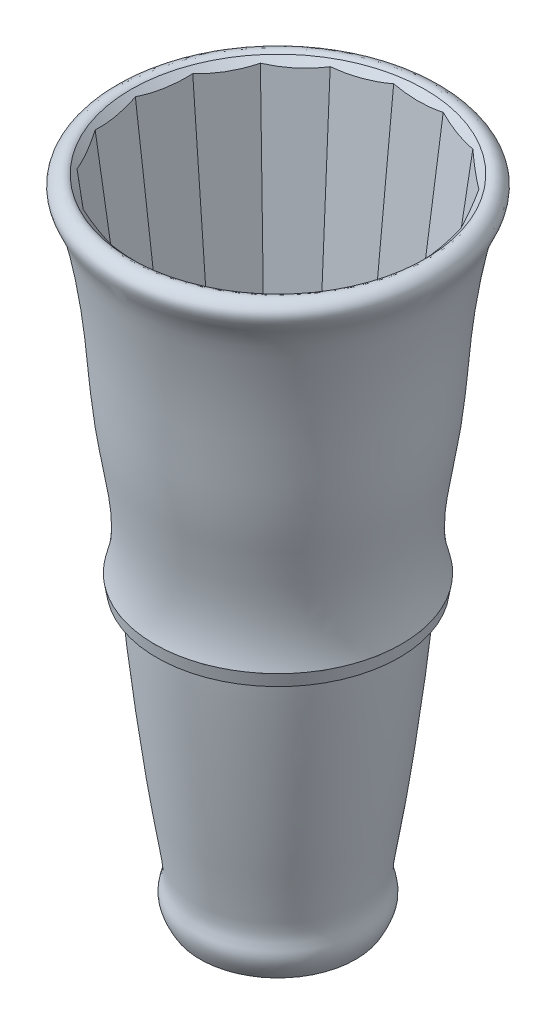
from build123d import *

# Parameters (mm, degrees)
LOFT1_DEPTH        = 508
LOFT1_TAPER        = -7.093868
SHELL1_T           = -19.05
SKETCH5_R          = 147.867108762
CUT_EXTRUDE1_DEPTH = 20
CUT_EXTRUDE2_DEPTH = 526.768458633
CUT_EXTRUDE2_TAPER = -20
CIRPATTERN1_COUNT  = 18


with BuildPart() as part:
    # Loft1: read off the stored shape, not the designer's step
    # Loft1 outline → Loft1 (new body)
    with BuildSketch(Plane(origin=(0, -508, 0), x_dir=(1, 0, 0), z_dir=(0, 1, 0))):
        Polygon((31.896938478, -55.24711805), (48.868944947, -41.005913681), (59.946635427, -21.81879094), (63.793876956, 0), (59.946635427, 21.81879094), (48.868944947, 41.005913681), (31.896938478, 55.24711805), (11.07769048, 62.824704621), (-11.07769048, 62.824704621), (-31.896938478, 55.24711805), (-48.868944947, 41.005913681), (-59.946635427, 21.81879094), (-63.793876956, 0), (-59.946635427, -21.81879094), (-48.868944947, -41.005913681), (-31.896938478, -55.24711805), (-11.07769048, -62.824704621), (11.07769048, -62.824704621), align=None)
    extrude(amount=LOFT1_DEPTH, taper=LOFT1_TAPER)

    # Shell1
    shell1_openings = [part.faces().sort_by_distance(p)[0] for p in [
        (0, 0, 0),
    ]]
    offset(amount=SHELL1_T, openings=shell1_openings, kind=Kind.INTERSECTION)

    # Sketch5 → Cut-Extrude1 (cut)
    with BuildSketch(Plane.XZ.offset(508)):
        Circle(SKETCH5_R)
    extrude(amount=-CUT_EXTRUDE1_DEPTH, mode=Mode.SUBTRACT)

    # Sketch6 → Cut-Extrude2 (cut, through all)
    with BuildSketch(Plane(origin=(-57.914835054, -472.553286642, -10.211948003), x_dir=(0.173648177666931, 0, -0.984807753012208), z_dir=(-0.12161910183404463, -0.9923451605496023, -0.021444729022872505))):
        Polygon((-11.516560933, 125.079390032), (-8.131620777, 106.029390032), (8.131620777, 106.029390032), (11.516560933, 125.079390032), align=None)
    cut_extrude2 = extrude(amount=CUT_EXTRUDE2_DEPTH, taper=CUT_EXTRUDE2_TAPER, mode=Mode.SUBTRACT)

    # CirPattern1: Cut-Extrude2 ×18 about axis
    cirpattern1_axis = Axis((0, 0, 0), (0, 1, 0))
    for i in range(1, CIRPATTERN1_COUNT):
        add(cut_extrude2.rotate(cirpattern1_axis, i * 360 / CIRPATTERN1_COUNT), mode=Mode.SUBTRACT)

    # Sketch8 → Cut-Revolve2 (revolve, cut)
    with BuildSketch(Plane.XY, mode=Mode.PRIVATE) as cut_revolve2_sk:
        with BuildLine():
            Line((57.063188191, -490.016704301), (76.914132607, -490.016704301))
            Line((76.914132607, -490.016704301), (141.822720492, 10.638098649))
            Line((141.822720492, 10.638098649), (99.989622053, 6.074813651))
            Line((99.989622053, 6.074813651), (101.324150646, -12.758188669))
            Line((101.324150646, -12.758188669), (110.947392304, -3.134947011))
            add(Edge.make_bspline(
                [(93.237262818, -263.789439232), (83.635916043, -234.235082042), (104.182445296, -154.258885956), (101.106713499, -94.098259508), (117.168877248, -23.536923001), (128.607184018, -8.099159871), (115.103455662, -0.326137231), (110.947392304, -3.134947011)],
                knots=[0, 0, 0, 0, 0.33850499, 0.818253197, 0.879592269, 0.951895703, 1, 1, 1, 1], degree=3))
            Line((93.237262818, -263.789439232), (91.603996913, -273.441057098))
            Line((91.603996913, -273.441057098), (83.863787721, -273.441057098))
            add(Edge.make_bspline(
                [(57.063188191, -490.016704301), (69.314509526, -470.2811603), (57.973613498, -468.157258009), (71.150739122, -400.748697646), (82.657499187, -297.566827785), (83.863787721, -273.441057098)],
                knots=[0, 0, 0, 0, 0.25681103, 0.397471242, 1, 1, 1, 1], degree=3))
        make_face()
    revolve(cut_revolve2_sk.sketch.rotate(Axis((0, 19.581938079, 0), (0, -1, 0)), 180), axis=Axis((0, 19.581938079, 0), (0, -1, 0)), mode=Mode.SUBTRACT)


solid = part.part
